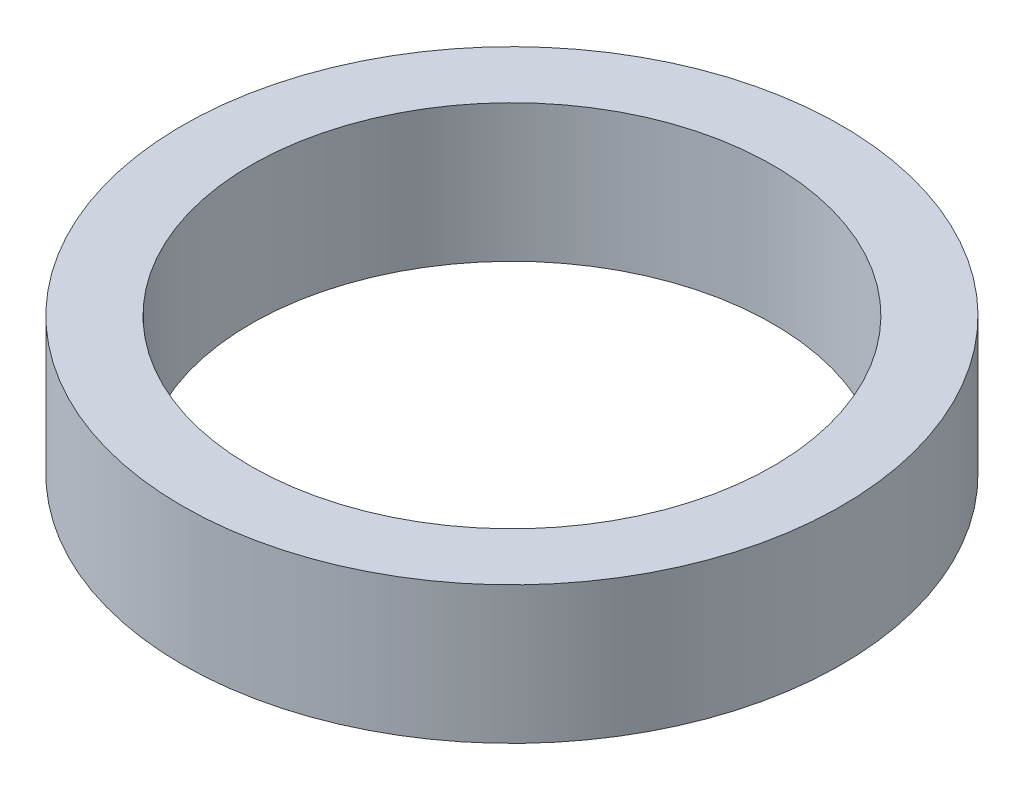
from build123d import *

# Parameters (mm, degrees)
SKETCH1_R           = 60
BOSS_EXTRUDE1_DEPTH = 25
SKETCH2_R           = 47.5
CUT_EXTRUDE1_DEPTH  = 89.459030065


with BuildPart() as part:
    # Sketch1 → Boss-Extrude1 (new body)
    with BuildSketch(Plane(origin=(0, 0, 0), x_dir=(1, 0, 0), z_dir=(0, 1, 0))):
        Circle(SKETCH1_R)
    extrude(amount=BOSS_EXTRUDE1_DEPTH)

    # Sketch2 → Cut-Extrude1 (cut, through all)
    with BuildSketch(Plane(origin=(0, 0, 0), x_dir=(1, 0, 0), z_dir=(0, 1, 0))):
        Circle(SKETCH2_R)
    extrude(amount=CUT_EXTRUDE1_DEPTH, mode=Mode.SUBTRACT)


solid = part.part
